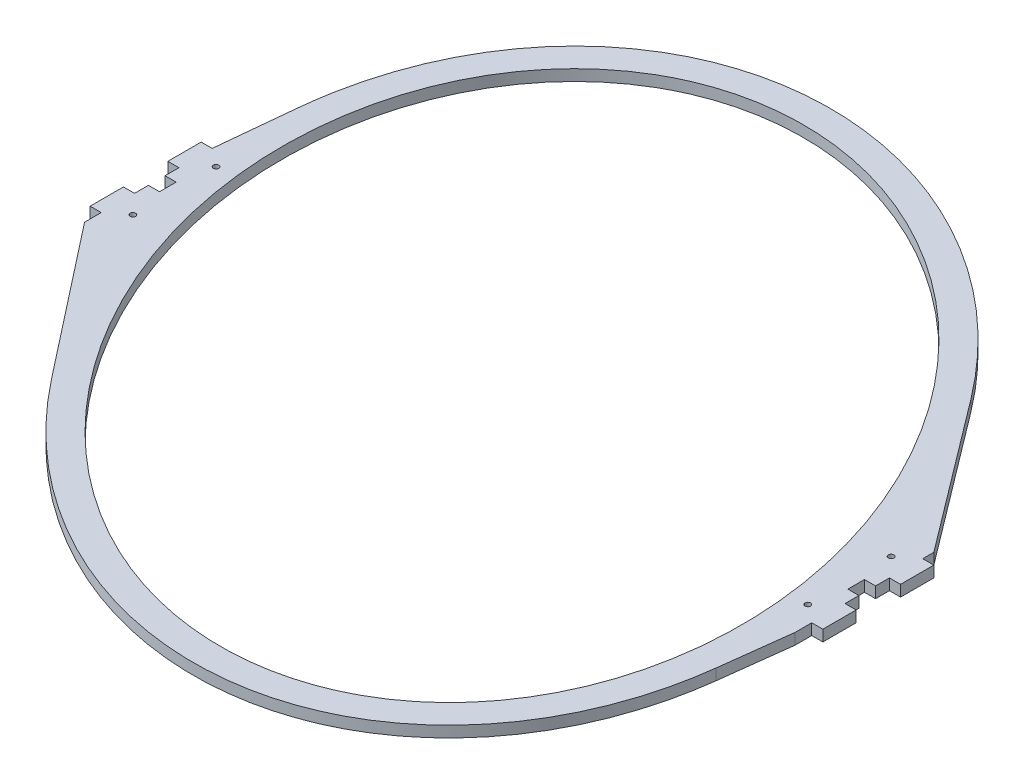
from build123d import *

# Parameters (mm, degrees)
SKETCH1_RX                   = 355
SKETCH1_RY                   = 265
BOSS_EXTRUDE1_DEPTH          = 10
SKETCH2_W                    = 10
SKETCH2_H                    = 15
CUT_EXTRUDE1_DEPTH           = 10
F_5_0_5_DIAMETER_HOLE2_D     = 5
F_5_0_5_DIAMETER_HOLE2_DEPTH = 25
F_5_0_5_DIAMETER_HOLE2_TIP   = 1.502151548


with BuildPart() as part:
    # Sketch1 → Boss-Extrude1 (new body)
    with BuildSketch(Plane(origin=(0, 0, 0), x_dir=(1, 0, 0), z_dir=(0, 1, 0))):
        with BuildLine():
            Line((-320, 50), (-320, 51))
            Line((-320, 51), (-313.091302172, 120.09271769))
            add(Edge.make_bspline(
                [(217.547896668, 195.738545202), (-244.337364097, 807.689215884), (-313.091302172, 120.09271769)],
                knots=[4.872921291, 4.872921291, 4.872921291, 7.098478155, 7.098478155, 7.098478155], degree=2, weights=[1, 0.442171166, 1]))
            Line((217.547896668, 195.738545202), (320, 60))
            Line((320, 60), (320, 50))
            Line((320, 50), (330, 50))
            Line((330, 50), (330, 20))
            Line((330, 20), (320, 20))
            Line((320, 20), (320, 0))
            Line((320, 0), (320, -20))
            Line((320, -20), (330, -20))
            Line((330, -20), (330, -50))
            Line((330, -50), (320, -50))
            Line((320, -50), (320, -65))
            Line((320, -65), (312.170159719, -128.33520269))
            add(Edge.make_bspline(
                [(-212.28214963, -202.588475219), (232.721291269, -770.993291043), (312.170159719, -128.33520269)],
                knots=[1.754206291, 1.754206291, 1.754206291, 3.932461359, 3.932461359, 3.932461359], degree=2, weights=[1, 0.463258742, 1]))
            Line((-212.28214963, -202.588475219), (-320, -65))
            Line((-320, -65), (-320, -50))
            Line((-320, -50), (-330, -50))
            Line((-330, -50), (-330, -20))
            Line((-330, -20), (-320, -20))
            Line((-320, -20), (-320, 0))
            Line((-320, 0), (-320, 20))
            Line((-320, 20), (-330, 20))
            Line((-330, 20), (-330, 50))
            Line((-330, 50), (-320, 50))
        make_face()
        with Locations(Location((0, 0), (0, 0, 120))):
            Ellipse(SKETCH1_RX, SKETCH1_RY, mode=Mode.SUBTRACT)
    extrude(amount=BOSS_EXTRUDE1_DEPTH)

    # Sketch2 → Cut-Extrude1 (cut)
    with BuildSketch(Plane(origin=(0, 10, 0), x_dir=(1, 0, 0), z_dir=(0, 1, 0))):
        with Locations((315, 0)):
            Rectangle(SKETCH2_W, SKETCH2_H)
        with Locations((-315, 0)):
            Rectangle(SKETCH2_W, SKETCH2_H)
    extrude(amount=-CUT_EXTRUDE1_DEPTH, mode=Mode.SUBTRACT)

    # Ø5.0 (5) Diameter Hole2
    with Locations(Plane(origin=(0, 10, 0), x_dir=(1, 0, 0), z_dir=(0, 1, 0))):
        with Locations((304, 37.5), (304, -37.5), (-304, -37.5), (-304, 37.5)):
            Hole(F_5_0_5_DIAMETER_HOLE2_D / 2, depth=F_5_0_5_DIAMETER_HOLE2_DEPTH)
            with Locations((0, 0, -(F_5_0_5_DIAMETER_HOLE2_DEPTH + F_5_0_5_DIAMETER_HOLE2_TIP / 2))):  # 118° drill point
                Cone(0, F_5_0_5_DIAMETER_HOLE2_D / 2, F_5_0_5_DIAMETER_HOLE2_TIP, mode=Mode.SUBTRACT)


solid = part.part
